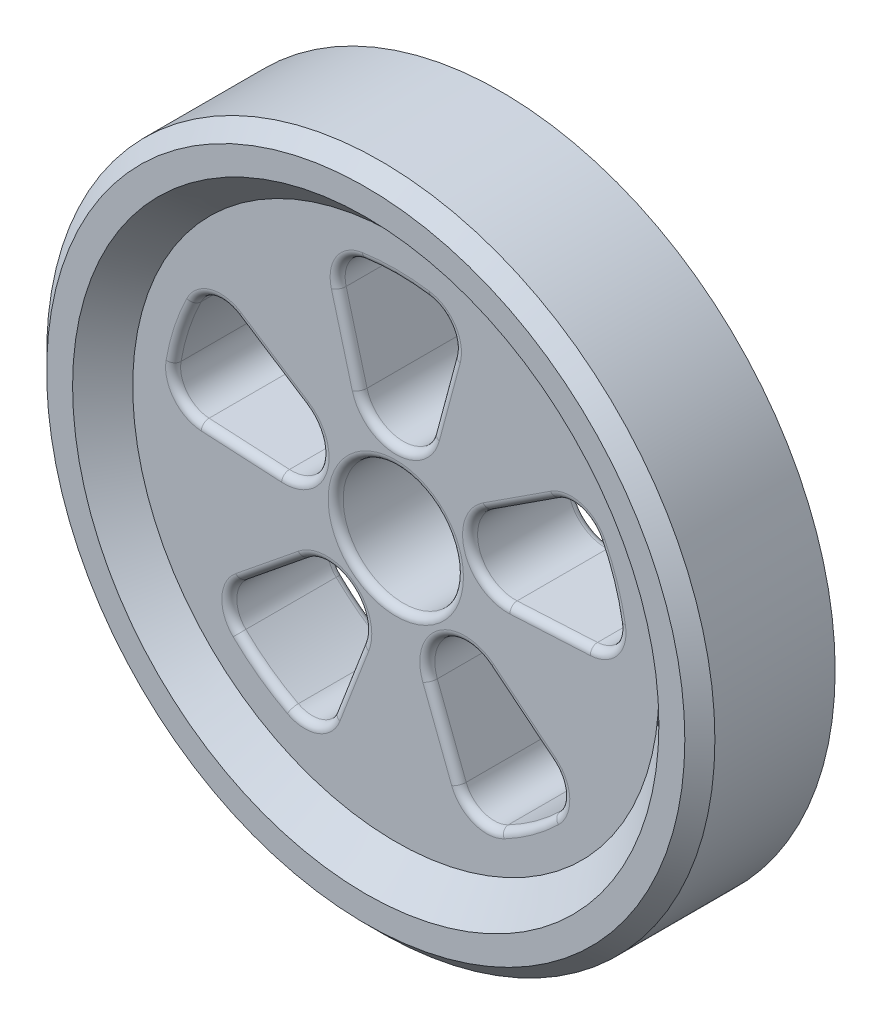
from build123d import *

# Parameters (mm, degrees)
SKETCH1_R           = 22.225
SKETCH1_R_2         = 4
BOSS_EXTRUDE1_DEPTH = 4.5
SKETCH2_R           = 17.5
CUT_EXTRUDE1_DEPTH  = 2
CHAMFER1_SIZE       = 2
CHAMFER2_SIZE       = 1
FILLET4_R           = 0.5


with BuildPart() as part:
    # Sketch1 → Boss-Extrude1 (new, symmetric)
    with BuildSketch(Plane.XY):
        Circle(SKETCH1_R)
        Circle(SKETCH1_R_2, mode=Mode.SUBTRACT)
        with BuildLine():
            Line((-2.414814566, 7.174572795), (-3.800845055, 12.347309001))
            ThreePointArc((-3.800845055, 12.347309001), (-3.539322818, 13.964946929), (-2.156530849, 14.844169721))
            ThreePointArc((-2.156530849, 14.844169721), (0, 15), (2.156530849, 14.844169721))
            ThreePointArc((2.156530849, 14.844169721), (3.539322818, 13.964946929), (3.800845055, 12.347309001))
            Line((3.800845055, 12.347309001), (2.414814566, 7.174572795))
            ThreePointArc((2.414814566, 7.174572795), (0, 5.321620408), (-2.414814566, 7.174572795))
        make_face(mode=Mode.SUBTRACT)
        with BuildLine():
            Line((7.569642947, -0.079560207), (12.917514399, 0.200709859))
            ThreePointArc((12.917514399, 0.200709859), (14.375164676, 0.949309897), (14.784049023, 2.536117995))
            ThreePointArc((14.784049023, 2.536117995), (14.265847744, 4.635254916), (13.451239661, 6.638083427))
            ThreePointArc((13.451239661, 6.638083427), (12.187742877, 7.681501956), (10.568462969, 7.430346773))
            Line((10.568462969, 7.430346773), (6.077205469, 4.513690049))
            ThreePointArc((6.077205469, 4.513690049), (5.061161766, 1.644471144), (7.569642947, -0.079560207))
        make_face(mode=Mode.SUBTRACT)
        with BuildLine():
            Line((2.263482058, -7.223743707), (4.182617894, -12.223263486))
            ThreePointArc((4.182617894, -12.223263486), (5.345017546, -13.378241147), (6.980513939, -13.2767626))
            ThreePointArc((6.980513939, -13.2767626), (8.816778784, -12.135254916), (10.46985415, -10.741608542))
            ThreePointArc((10.46985415, -10.741608542), (11.071762162, -9.217517636), (10.332514379, -7.755102147))
            Line((10.332514379, -7.755102147), (6.170734102, -4.38495893))
            ThreePointArc((6.170734102, -4.38495893), (3.127969994, -4.305281347), (2.263482058, -7.223743707))
        make_face(mode=Mode.SUBTRACT)
        with BuildLine():
            Line((-6.170734102, -4.38495893), (-10.332514379, -7.755102147))
            ThreePointArc((-10.332514379, -7.755102147), (-11.071762162, -9.217517636), (-10.46985415, -10.741608542))
            ThreePointArc((-10.46985415, -10.741608542), (-8.816778784, -12.135254916), (-6.980513939, -13.2767626))
            ThreePointArc((-6.980513939, -13.2767626), (-5.345017546, -13.378241147), (-4.182617894, -12.223263486))
            Line((-4.182617894, -12.223263486), (-2.263482058, -7.223743707))
            ThreePointArc((-2.263482058, -7.223743707), (-3.127969994, -4.305281347), (-6.170734102, -4.38495893))
        make_face(mode=Mode.SUBTRACT)
        with BuildLine():
            Line((-6.077205469, 4.513690049), (-10.568462969, 7.430346773))
            ThreePointArc((-10.568462969, 7.430346773), (-12.187742877, 7.681501956), (-13.451239661, 6.638083427))
            ThreePointArc((-13.451239661, 6.638083427), (-14.265847744, 4.635254916), (-14.784049023, 2.536117995))
            ThreePointArc((-14.784049023, 2.536117995), (-14.375164676, 0.949309897), (-12.917514399, 0.200709859))
            Line((-12.917514399, 0.200709859), (-7.569642947, -0.079560207))
            ThreePointArc((-7.569642947, -0.079560207), (-5.061161766, 1.644471144), (-6.077205469, 4.513690049))
        make_face(mode=Mode.SUBTRACT)
    extrude(amount=BOSS_EXTRUDE1_DEPTH, both=True)

    # Sketch2 → Cut-Extrude1 (cut)
    with BuildSketch(Plane.XY.offset(4.5)):
        Circle(SKETCH2_R)
    extrude(amount=-CUT_EXTRUDE1_DEPTH, mode=Mode.SUBTRACT)

    # Chamfer1
    chamfer1_edges = [part.edges().sort_by_distance(p)[0] for p in [
        (-17.5, 0, 4.5),
    ]]
    chamfer(chamfer1_edges, length=CHAMFER1_SIZE - 0.0001)  # a hair under: the kernel refuses the full size

    # Chamfer2
    chamfer2_edges = [part.edges().sort_by_distance(p)[0] for p in [
        (-22.225, 0, 4.5),
    ]]
    chamfer(chamfer2_edges, length=CHAMFER2_SIZE)

    # Fillet4
    fillet4_edges = [part.edges().sort_by_distance(p)[0] for p in [
        (-3.127969994, -4.305281347, 2.5),
        (-3.223049976, -9.723503597, 2.5),
        (-5.345017546, -13.378241147, 2.5),
        (3.127969994, -4.305281347, 2.5),
        (8.25162424, -6.070030538, 2.5),
        (11.071762162, -9.217517636, 2.5),
        (5.061161766, 1.644471144, 2.5),
        (8.322834219, 5.972018411, 2.5),
        (12.187742877, 7.681501956, 2.5),
        (-8.25162424, -6.070030538, 2.5),
        (-11.071762162, -9.217517636, 2.5),
        (-8.816778784, -12.135254916, 2.5),
        (3.223049976, -9.723503597, 2.5),
        (5.345017546, -13.378241147, 2.5),
        (8.816778784, -12.135254916, 2.5),
        (10.243578673, 0.060574826, 2.5),
        (14.375164676, 0.949309897, 2.5),
        (14.265847744, 4.635254916, 2.5),
        (-8.322834219, 5.972018411, 2.5),
        (-14.265847744, 4.635254916, 2.5),
        (-4, 0, 2.5),
        (3.10782981, 9.760940898, 2.5),
        (3.539322818, 13.964946929, 2.5),
        (0, 15, 2.5),
        (-5.061161766, 1.644471144, 2.5),
        (-10.243578673, 0.060574826, 2.5),
        (-14.375164676, 0.949309897, 2.5),
        (0, 5.321620408, 2.5),
        (-3.10782981, 9.760940898, 2.5),
        (-3.539322818, 13.964946929, 2.5),
        (-12.187742877, 7.681501956, -4.5),
        (-14.265847744, 4.635254916, -4.5),
        (-14.375164676, 0.949309897, -4.5),
        (-10.243578673, 0.060574826, -4.5),
        (-5.061161766, 1.644471144, -4.5),
        (-8.322834219, 5.972018411, -4.5),
        (-11.071762162, -9.217517636, -4.5),
        (-8.816778784, -12.135254916, -4.5),
        (-5.345017546, -13.378241147, -4.5),
        (-3.223049976, -9.723503597, -4.5),
        (-3.127969994, -4.305281347, -4.5),
        (-8.25162424, -6.070030538, -4.5),
        (5.345017546, -13.378241147, -4.5),
        (8.816778784, -12.135254916, -4.5),
        (11.071762162, -9.217517636, -4.5),
        (8.25162424, -6.070030538, -4.5),
        (3.127969994, -4.305281347, -4.5),
        (3.223049976, -9.723503597, -4.5),
        (14.375164676, 0.949309897, -4.5),
        (14.265847744, 4.635254916, -4.5),
        (12.187742877, 7.681501956, -4.5),
        (8.322834219, 5.972018411, -4.5),
        (5.061161766, 1.644471144, -4.5),
        (10.243578673, 0.060574826, -4.5),
        (0, 5.321620408, -4.5),
        (3.10782981, 9.760940898, -4.5),
        (3.539322818, 13.964946929, -4.5),
        (0, 15, -4.5),
        (-3.539322818, 13.964946929, -4.5),
        (-3.10782981, 9.760940898, -4.5),
        (-4, 0, -4.5),
        (-12.187742877, 7.681501956, 2.5),
    ]]
    fillet(fillet4_edges, radius=FILLET4_R)


solid = part.part
